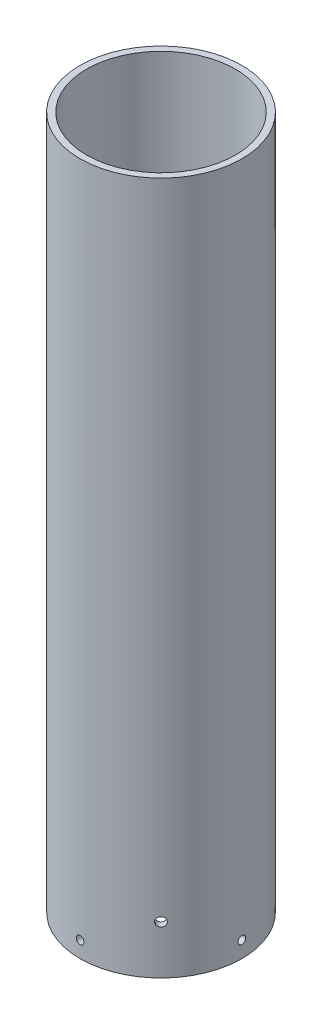
from build123d import *

# Parameters (mm, degrees)
SKETCH_1_R               = 25
SKETCH_1_R_2             = 23
EXTRUDE_1_DEPTH          = 214
SKETCH_5_R               = 1.2
CUT_EXTRUDE_5_DEPTH      = 217.90089903
PATTERN_CIRCULAR_1_COUNT = 4
SKETCH_6_R               = 1.4
CUT_EXTRUDE_6_DEPTH      = 217.900899153
PATTERN_CIRCULAR_2_COUNT = 4


with BuildPart() as part:
    # Эскиз1 → Бобышка-Вытянуть1 (new body)
    with BuildSketch(Plane(origin=(0, 0, 0), x_dir=(1, 0, 0), z_dir=(0, 1, 0))):
        Circle(SKETCH_1_R)
        Circle(SKETCH_1_R_2, mode=Mode.SUBTRACT)
    extrude(amount=EXTRUDE_1_DEPTH)

    # Эскиз5 → Вырез-Вытянуть5 (cut, through all)
    with BuildSketch(Plane.XY):
        with Locations((0, 5)):
            Circle(SKETCH_5_R)
    cut_extrude_5 = extrude(amount=-CUT_EXTRUDE_5_DEPTH, mode=Mode.SUBTRACT)

    # Круговой массив1: Вырез-Вытянуть5 ×4 about axis
    pattern_circular_1_axis = Axis((0, 214, 0), (0, -1, 0))
    for i in range(1, PATTERN_CIRCULAR_1_COUNT):
        add(cut_extrude_5.rotate(pattern_circular_1_axis, i * 360 / PATTERN_CIRCULAR_1_COUNT), mode=Mode.SUBTRACT)

    # Эскиз6 → Вырез-Вытянуть6 (cut, through all)
    with BuildSketch(Plane(origin=(0, 0, 0), x_dir=(0, -1, 0), z_dir=(-0.7071067811865488, 0, 0.7071067811865464))):
        with Locations((-15, 0)):
            Circle(SKETCH_6_R)
    cut_extrude_6 = extrude(amount=-CUT_EXTRUDE_6_DEPTH, mode=Mode.SUBTRACT)

    # Круговой массив2: Вырез-Вытянуть6 ×4 about axis
    pattern_circular_2_axis = Axis((0, 214, 0), (0, -1, 0))
    for i in range(1, PATTERN_CIRCULAR_2_COUNT):
        add(cut_extrude_6.rotate(pattern_circular_2_axis, i * 360 / PATTERN_CIRCULAR_2_COUNT), mode=Mode.SUBTRACT)


solid = part.part
